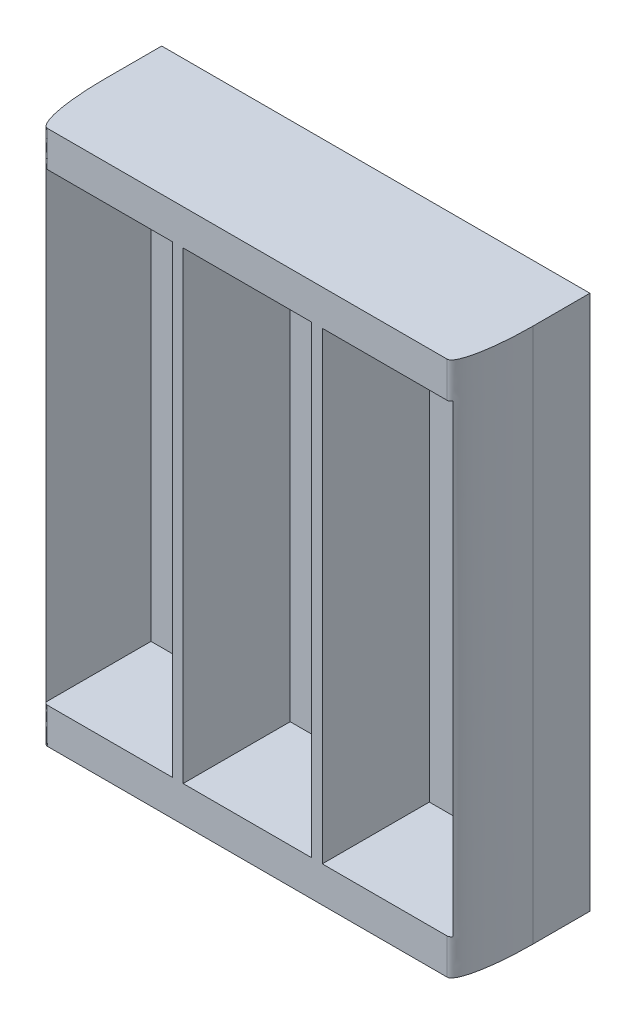
from build123d import *

# Parameters (mm, degrees)
SKETCH1_W           = 60
SKETCH1_H           = 18
BOSS_EXTRUDE1_DEPTH = 75
SKETCH2_W           = 18
SKETCH2_H           = 65
CUT_EXTRUDE1_DEPTH  = 15
FILLET1_SIZE        = 10
FILLET1_SIZE_2      = 2


with BuildPart() as part:
    # Sketch1 → Boss-Extrude1 (new body)
    with BuildSketch(Plane(origin=(0, 0, 0), x_dir=(1, 0, 0), z_dir=(0, 1, 0))):
        with Locations((0, -9)):
            Rectangle(SKETCH1_W, SKETCH1_H)
    extrude(amount=BOSS_EXTRUDE1_DEPTH)

    # Sketch2 → Cut-Extrude1 (cut)
    with BuildSketch(Plane.XY.offset(18)):
        with Locations((-19.5, 37.5)):
            Rectangle(SKETCH2_W, SKETCH2_H)
        with Locations((0, 37.5)):
            Rectangle(SKETCH2_W, SKETCH2_H)
        with Locations((19.5, 37.5)):
            Rectangle(SKETCH2_W, SKETCH2_H)
    extrude(amount=-CUT_EXTRUDE1_DEPTH, mode=Mode.SUBTRACT)

    # Fillet1
    # an asymmetric fillet: 10, 2 mm, written as the material it takes off along each edge
    with BuildSketch(Plane(origin=(-30, -25, 18), x_dir=(0, 0, -1), z_dir=(0, 1, 0))) as fillet1_piece_1:
        with BuildLine():
            Bezier((FILLET1_SIZE, 0), (0, 0), (0, -FILLET1_SIZE_2), weights=[1, 0.707106781, 1])
            Line((0, -FILLET1_SIZE_2), (0, 0))
            Line((0, 0), (FILLET1_SIZE, 0))
        make_face()
    extrude(amount=125, mode=Mode.SUBTRACT)
    with BuildSketch(Plane(origin=(30, -25, 18), x_dir=(0, 0, -1), z_dir=(0, 1, 0))) as fillet1_piece_2:
        with BuildLine():
            Bezier((FILLET1_SIZE, 0), (0, 0), (0, FILLET1_SIZE_2), weights=[1, 0.707106781, 1])
            Line((0, FILLET1_SIZE_2), (0, 0))
            Line((0, 0), (FILLET1_SIZE, 0))
        make_face()
    extrude(amount=125, mode=Mode.SUBTRACT)


solid = part.part
